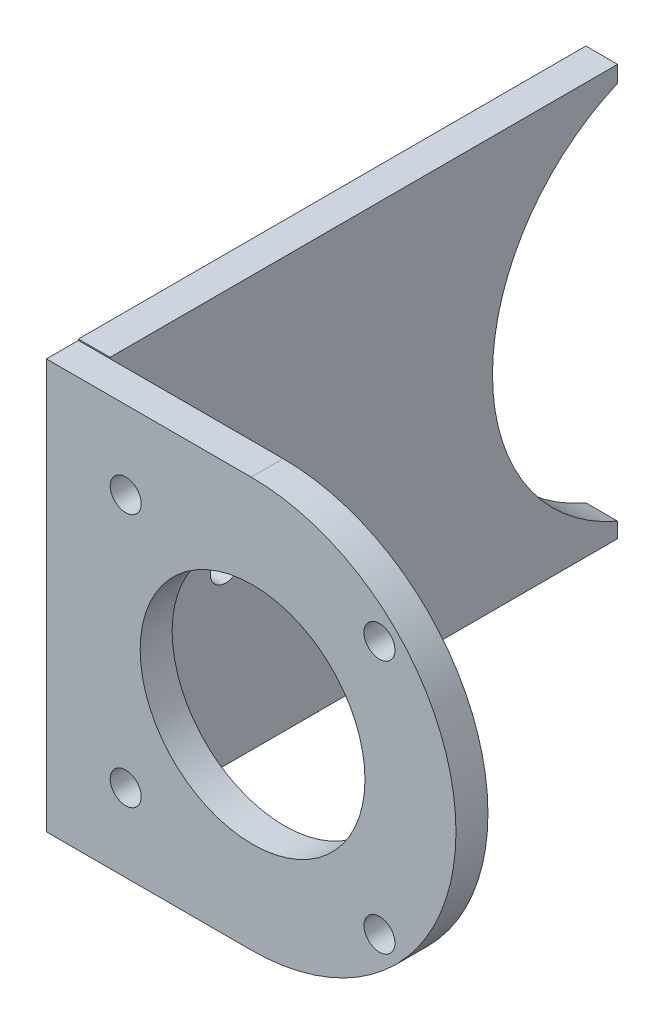
from build123d import *

# Parameters (mm, degrees)
EXTRUDE1_DEPTH     = 3.2
SKETCH2_R          = 11.25
CUT_EXTRUDE1_DEPTH = 61.417603842
SKETCH3_R          = 1.55
CUT_EXTRUDE2_DEPTH = 61.417603842
SKETCH5_W          = 3.175
SKETCH5_H          = 41.124335646
EXTRUDE3_DEPTH     = 50.8
SKETCH6_R          = 20.6375
SKETCH6_R_2        = 1.55
CUT_EXTRUDE3_DEPTH = 77.474752637


with BuildPart() as part:
    # Sketch1 → Extrude1 (new body)
    with BuildSketch(Plane.XY):
        with BuildLine():
            Line((1.587120553, 42.737778657), (1.5875, 22.571842089))
            Line((1.5875, 22.571842089), (1.5875, 1.738164354))
            Line((1.5875, 1.738164354), (22.08554937, 1.738164354))
            ThreePointArc((22.08554937, 1.738164354), (42.585163633, 22.238550083), (22.084777904, 42.738164346))
            Line((22.084777904, 42.738164346), (1.587120553, 42.737778657))
        make_face()
    extrude(amount=EXTRUDE1_DEPTH)

    # Sketch2 → Cut-Extrude1 (cut, through all)
    with BuildSketch(Plane.XY.offset(3.2)):
        with Locations((22.225, 22.225)):
            Circle(SKETCH2_R)
    extrude(amount=-CUT_EXTRUDE1_DEPTH, mode=Mode.SUBTRACT)

    # Sketch3 → Cut-Extrude2 (cut, through all)
    with BuildSketch(Plane.XY.offset(3.2)):
        with Locations((34.925, 34.925)):
            Circle(SKETCH3_R)
        with Locations((9.525, 34.925)):
            Circle(SKETCH3_R)
        with Locations((34.925, 9.525)):
            Circle(SKETCH3_R)
        with Locations((9.525, 9.525)):
            Circle(SKETCH3_R)
    extrude(amount=-CUT_EXTRUDE2_DEPTH, mode=Mode.SUBTRACT)

    # Sketch5 → Extrude3 (add)
    with BuildSketch(Plane(origin=(0, 0, 0), x_dir=(-1, 0, 0), z_dir=(0, 0, -1))):
        with Locations((-3.175, 22.300332177)):
            Rectangle(SKETCH5_W, SKETCH5_H)
    extrude(amount=EXTRUDE3_DEPTH)

    # Sketch6 → Cut-Extrude3 (cut, through all)
    with BuildSketch(Plane(origin=(4.7625, 0, 0), x_dir=(0, 0, -1), z_dir=(1, 0, 0))):
        with Locations((58.9125, 22.23816435)):
            Circle(SKETCH6_R)
        with Locations((5.225, 25.41316435)):
            Circle(SKETCH6_R_2)
        with Locations((11.575, 19.06316435)):
            Circle(SKETCH6_R_2)
    extrude(amount=-CUT_EXTRUDE3_DEPTH, mode=Mode.SUBTRACT)


solid = part.part
